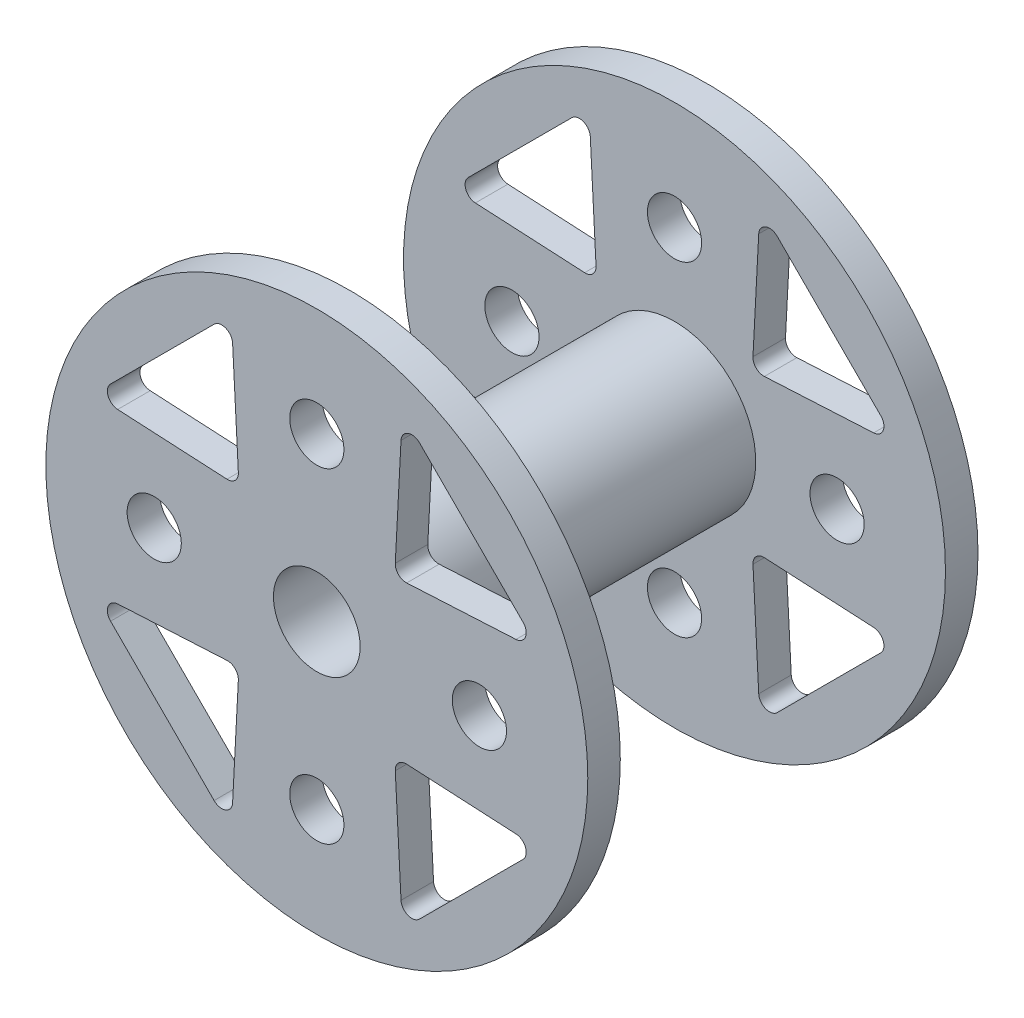
from build123d import *

# Parameters (mm, degrees)
CROQUIS1_R              = 7.5
CROQUIS1_R_2            = 4
SALIENTE_EXTRUIR1_DEPTH = 30
CROQUIS2_R              = 25
CROQUIS2_R_2            = 4
CROQUIS2_R_3            = 2.5
SALIENTE_EXTRUIR2_DEPTH = 3


with BuildPart() as part:
    # Croquis1 → Saliente-Extruir1 (new body)
    with BuildSketch(Plane.XY):
        Circle(CROQUIS1_R)
        Circle(CROQUIS1_R_2, mode=Mode.SUBTRACT)
    extrude(amount=SALIENTE_EXTRUIR1_DEPTH)

    # Croquis2 → Saliente-Extruir2 (add)
    with BuildSketch(Plane.XY.offset(30)):
        Circle(CROQUIS2_R)
        Circle(CROQUIS2_R_2, mode=Mode.SUBTRACT)
        with Locations((0, 15)):
            Circle(CROQUIS2_R_3, mode=Mode.SUBTRACT)
        with Locations((15, 0)):
            Circle(CROQUIS2_R_3, mode=Mode.SUBTRACT)
        with Locations((0, -15)):
            Circle(CROQUIS2_R_3, mode=Mode.SUBTRACT)
        with Locations((-15, 0)):
            Circle(CROQUIS2_R_3, mode=Mode.SUBTRACT)
        with BuildLine():
            Line((-19.027844597, 9.475344501), (-9.475344501, 19.027844597))
            ThreePointArc((-9.475344501, 19.027844597), (-8.409973952, 19.254358227), (-7.76961989, 18.373296649))
            Line((-7.76961989, 18.373296649), (-7.23892544, 8.290102103))
            ThreePointArc((-7.23892544, 8.290102103), (-7.530436489, 7.530436489), (-8.290102103, 7.23892544))
            Line((-8.290102103, 7.23892544), (-18.373296649, 7.76961989))
            ThreePointArc((-18.373296649, 7.76961989), (-19.254358227, 8.409973952), (-19.027844597, 9.475344501))
        make_face(mode=Mode.SUBTRACT)
        with BuildLine():
            Line((7.76961989, 18.373296649), (7.23892544, 8.290102103))
            ThreePointArc((7.23892544, 8.290102103), (7.530436489, 7.530436489), (8.290102103, 7.23892544))
            Line((8.290102103, 7.23892544), (18.373296649, 7.76961989))
            ThreePointArc((18.373296649, 7.76961989), (19.254358227, 8.409973952), (19.027844597, 9.475344501))
            Line((19.027844597, 9.475344501), (9.475344501, 19.027844597))
            ThreePointArc((9.475344501, 19.027844597), (8.409973952, 19.254358227), (7.76961989, 18.373296649))
        make_face(mode=Mode.SUBTRACT)
        with BuildLine():
            Line((18.373296649, -7.76961989), (8.290102103, -7.23892544))
            ThreePointArc((8.290102103, -7.23892544), (7.530436489, -7.530436489), (7.23892544, -8.290102103))
            Line((7.23892544, -8.290102103), (7.76961989, -18.373296649))
            ThreePointArc((7.76961989, -18.373296649), (8.409973952, -19.254358227), (9.475344501, -19.027844597))
            Line((9.475344501, -19.027844597), (19.027844597, -9.475344501))
            ThreePointArc((19.027844597, -9.475344501), (19.254358227, -8.409973952), (18.373296649, -7.76961989))
        make_face(mode=Mode.SUBTRACT)
        with BuildLine():
            Line((-7.76961989, -18.373296649), (-7.23892544, -8.290102103))
            ThreePointArc((-7.23892544, -8.290102103), (-7.530436489, -7.530436489), (-8.290102103, -7.23892544))
            Line((-8.290102103, -7.23892544), (-18.373296649, -7.76961989))
            ThreePointArc((-18.373296649, -7.76961989), (-19.254358227, -8.409973952), (-19.027844597, -9.475344501))
            Line((-19.027844597, -9.475344501), (-9.475344501, -19.027844597))
            ThreePointArc((-9.475344501, -19.027844597), (-8.409973952, -19.254358227), (-7.76961989, -18.373296649))
        make_face(mode=Mode.SUBTRACT)
    saliente_extruir2 = extrude(amount=SALIENTE_EXTRUIR2_DEPTH)

    # Simetría1: Saliente-Extruir2 across plane
    add(saliente_extruir2.mirror(Plane(origin=(0, 0, 15), x_dir=(1, 0, 0), z_dir=(0, 0, -1))))


solid = part.part
